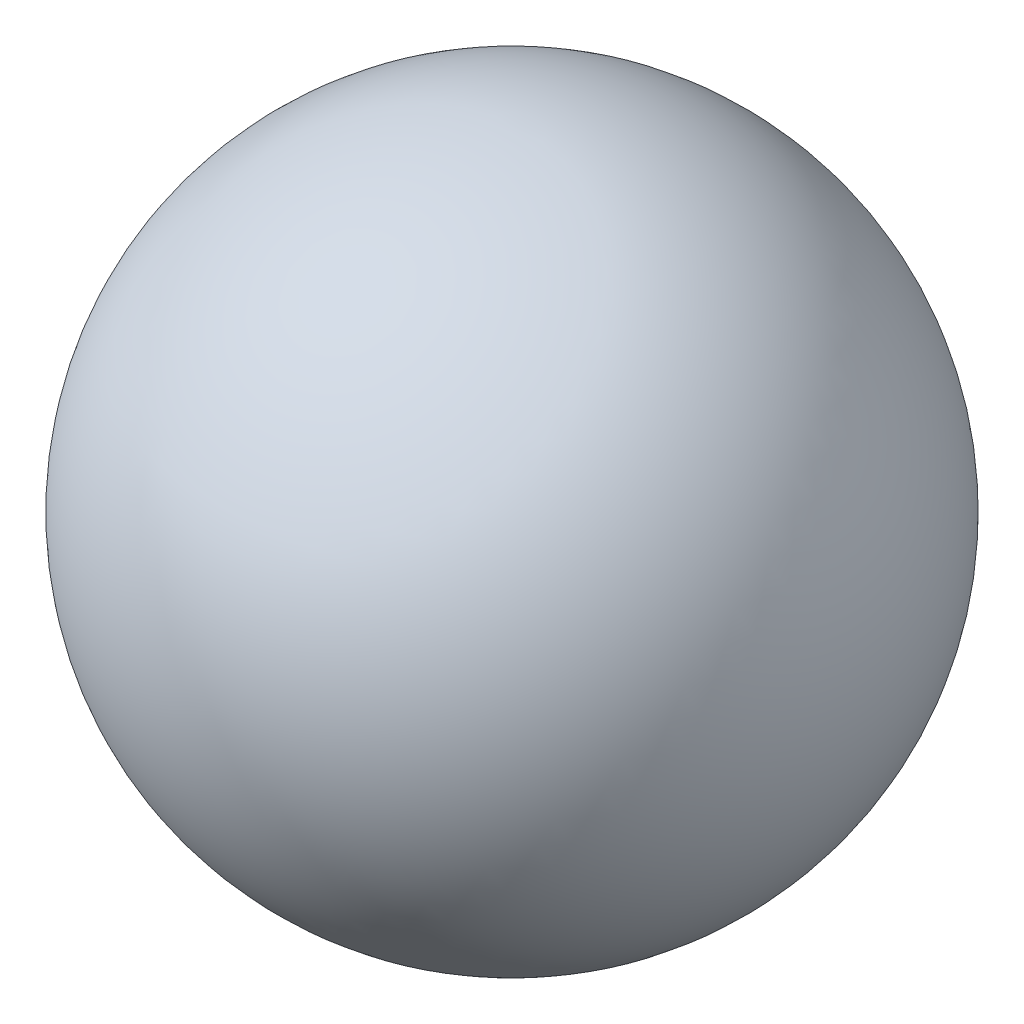
from build123d import *


with BuildPart() as part:
    # Sketch1 → Revolve1 (revolve)
    with BuildSketch(Plane.XY):
        with BuildLine():
            Line((0, -4.5), (0, 4.5))
            ThreePointArc((0, 4.5), (4.5, 0), (0, -4.5))
        make_face()
    revolve(axis=Axis((0, -4.5, 0), (0, 1, 0)))


solid = part.part
